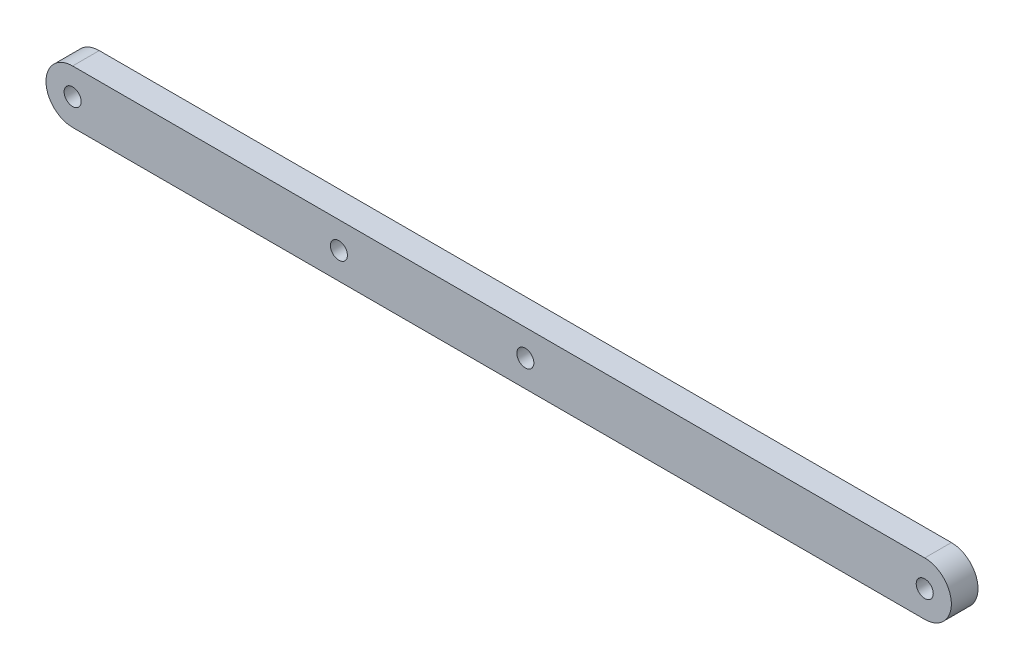
from build123d import *

# Parameters (mm, degrees)
SKETCH2_R           = 2.032
BOSS_EXTRUDE1_DEPTH = 3.175


with BuildPart() as part:
    # Sketch2 → Boss-Extrude1 (new, symmetric)
    with BuildSketch(Plane.XY):
        with BuildLine():
            Line((0, 6.35), (203.2, 6.35))
            ThreePointArc((203.2, 6.35), (209.55, 0), (203.2, -6.35))
            Line((203.2, -6.35), (0, -6.35))
            ThreePointArc((0, -6.35), (-6.35, 0), (0, 6.35))
        make_face()
        Circle(SKETCH2_R, mode=Mode.SUBTRACT)
        with Locations((203.2, 0)):
            Circle(SKETCH2_R, mode=Mode.SUBTRACT)
        with Locations((63.5, 0)):
            Circle(SKETCH2_R, mode=Mode.SUBTRACT)
        with Locations((107.95, 0)):
            Circle(SKETCH2_R, mode=Mode.SUBTRACT)
    extrude(amount=BOSS_EXTRUDE1_DEPTH, both=True)


solid = part.part
